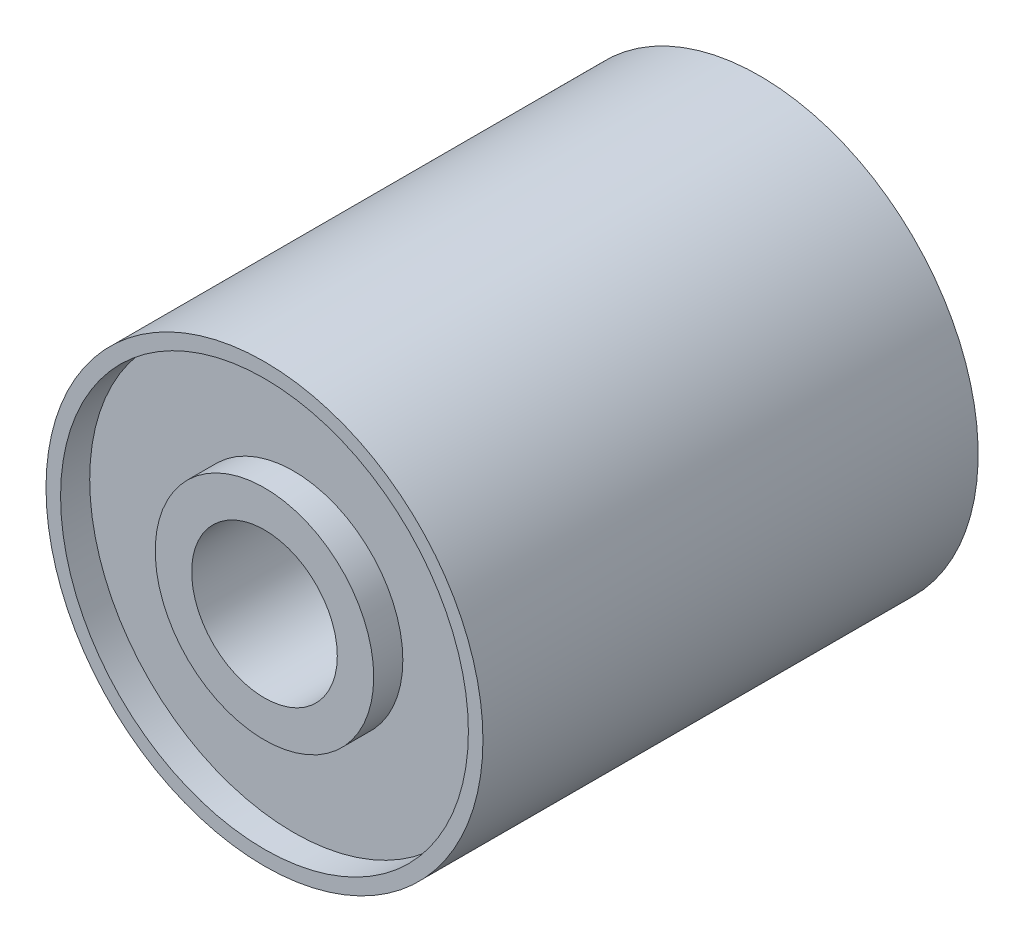
from build123d import *

# Parameters (mm, degrees)
SKETCH_1_R          = 1.5
EXTRUDE_1_DEPTH     = 3
SKETCH_2_R          = 1.5
SKETCH_2_R_2        = 1.4
EXTRUDE_2_DEPTH     = 0.2
EXTRUDE_START       = 0.2
SKETCH_3_R          = 1.5
SKETCH_3_R_2        = 1.4
EXTRUDE_3_DEPTH     = 0.2
SKETCH_4_R          = 0.75
SKETCH_4_R_2        = 0.5
EXTRUDE_4_DEPTH     = 0.2
SKETCH_5_R          = 0.75
SKETCH_5_R_2        = 0.5
EXTRUDE_5_DEPTH     = 0.2
SKETCH_7_R          = 0.5
CUT_EXTRUDE_2_DEPTH = 4.839270764


with BuildPart() as part:
    # 草图1 → 凸台-拉伸1 (new body)
    with BuildSketch(Plane.XY):
        Circle(SKETCH_1_R)
    extrude(amount=EXTRUDE_1_DEPTH)

    # 草图2 → 凸台-拉伸2 (add)
    with BuildSketch(Plane.XY.offset(3)):
        Circle(SKETCH_2_R)
        Circle(SKETCH_2_R_2, mode=Mode.SUBTRACT)
    extrude(amount=EXTRUDE_2_DEPTH)

    # 草图3 → 凸台-拉伸3 (add)
    with BuildSketch(Plane(origin=(0, 0, 0), x_dir=(-1, 0, 0), z_dir=(0, 0, -1)).offset(EXTRUDE_START)):
        Circle(SKETCH_3_R)
        Circle(SKETCH_3_R_2, mode=Mode.SUBTRACT)
    extrude(amount=-EXTRUDE_3_DEPTH)

    # 草图4 → 凸台-拉伸4 (add)
    with BuildSketch(Plane(origin=(0, 0, 0), x_dir=(-1, 0, 0), z_dir=(0, 0, -1))):
        Circle(SKETCH_4_R)
        Circle(SKETCH_4_R_2, mode=Mode.SUBTRACT)
    extrude(amount=EXTRUDE_4_DEPTH)

    # 草图5 → 凸台-拉伸5 (add)
    with BuildSketch(Plane.XY.offset(3).offset(EXTRUDE_START)):
        Circle(SKETCH_5_R)
        Circle(SKETCH_5_R_2, mode=Mode.SUBTRACT)
    extrude(amount=-EXTRUDE_5_DEPTH)

    # 草图7 → 切除-拉伸2 (cut, through all)
    with BuildSketch(Plane(origin=(0, 0, 0), x_dir=(-1, 0, 0), z_dir=(0, 0, -1))):
        Circle(SKETCH_7_R)
    extrude(amount=-CUT_EXTRUDE_2_DEPTH, mode=Mode.SUBTRACT)


solid = part.part
